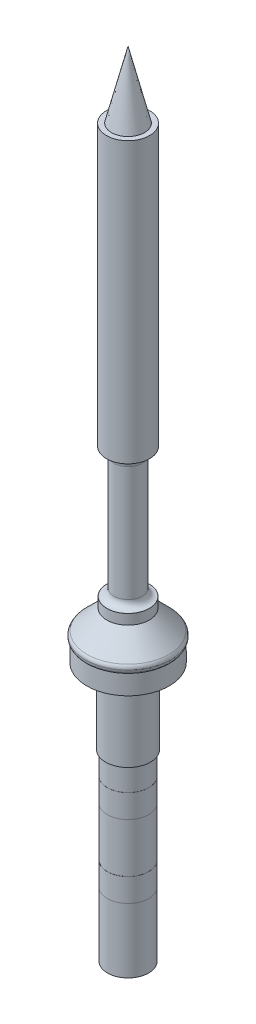
from build123d import *

# Parameters (mm, degrees)
SKETCH1_R            = 2.875
BOSS_EXTRUDE1_DEPTH  = 9.7
SKETCH2_R            = 5.3
BOSS_EXTRUDE2_DEPTH  = 2.5
SKETCH3_R            = 5.475
BOSS_EXTRUDE3_DEPTH  = 0.8
SKETCH4_R            = 5.475
BOSS_EXTRUDE4_DEPTH  = 2.75
BOSS_EXTRUDE4_TAPER  = 45
SKETCH5_R            = 2.725
BOSS_EXTRUDE5_DEPTH  = 1.3
SKETCH6_R            = 1.805
BOSS_EXTRUDE6_DEPTH  = 16.7
SKETCH7_R            = 2.775
BOSS_EXTRUDE7_DEPTH  = 36
SKETCH9_R            = 2.65
BOSS_EXTRUDE9_DEPTH  = 23.6
SKETCH10_R           = 2.66
SKETCH10_R_2         = 2.65
BOSS_EXTRUDE10_DEPTH = 3
SKETCH12_R           = 2.66
SKETCH12_R_2         = 2.65
BOSS_EXTRUDE11_DEPTH = 3
FILLET1_R            = 0.7
FILLET2_R            = 0.9
FILLET3_R            = 1
FILLET4_R            = 0.3


with BuildPart() as part:
    # Sketch1 → Boss-Extrude1 (new body)
    with BuildSketch(Plane(origin=(0, 0, 0), x_dir=(1, 0, 0), z_dir=(0, 1, 0))):
        with Locations(Location((0, 0, 0), (0, 0, 270))):
            Circle(SKETCH1_R)
    extrude(amount=BOSS_EXTRUDE1_DEPTH)

    # Sketch2 → Boss-Extrude2 (add)
    with BuildSketch(Plane(origin=(0, 9.7, 0), x_dir=(1, 0, 0), z_dir=(0, 1, 0))):
        with Locations(Location((0, 0, 0), (0, 0, 270))):
            Circle(SKETCH2_R)
    extrude(amount=BOSS_EXTRUDE2_DEPTH)

    # Sketch3 → Boss-Extrude3 (add)
    with BuildSketch(Plane(origin=(0, 12.2, 0), x_dir=(1, 0, 0), z_dir=(0, 1, 0))):
        with Locations(Location((0, 0, 0), (0, 0, 270))):
            Circle(SKETCH3_R)
    extrude(amount=BOSS_EXTRUDE3_DEPTH)

    # Sketch4 → Boss-Extrude4 (add)
    with BuildSketch(Plane(origin=(0, 13, 0), x_dir=(1, 0, 0), z_dir=(0, 1, 0))):
        with Locations(Location((0, 0, 0), (0, 0, 270))):
            Circle(SKETCH4_R)
    extrude(amount=BOSS_EXTRUDE4_DEPTH, taper=BOSS_EXTRUDE4_TAPER)

    # Sketch5 → Boss-Extrude5 (add)
    with BuildSketch(Plane(origin=(0, 15.75, 0), x_dir=(1, 0, 0), z_dir=(0, 1, 0))):
        with Locations(Location((0, 0, 0), (0, 0, 270))):
            Circle(SKETCH5_R)
    extrude(amount=BOSS_EXTRUDE5_DEPTH)

    # Sketch6 → Boss-Extrude6 (add)
    with BuildSketch(Plane(origin=(0, 17.05, 0), x_dir=(1, 0, 0), z_dir=(0, 1, 0))):
        with Locations(Location((0, 0, 0), (0, 0, 270))):
            Circle(SKETCH6_R)
    extrude(amount=BOSS_EXTRUDE6_DEPTH)

    # Sketch7 → Boss-Extrude7 (add)
    with BuildSketch(Plane(origin=(0, 33.75, 0), x_dir=(1, 0, 0), z_dir=(0, 1, 0))):
        with Locations(Location((0, 0, 0), (0, 0, 270))):
            Circle(SKETCH7_R)
    extrude(amount=BOSS_EXTRUDE7_DEPTH)

    # Boss-Extrude8 cone 1 section (through the dimple's axis) → Boss-Extrude8 (revolve)
    with BuildSketch(Plane(origin=(0, 69.75, 0), x_dir=(0, 0, -1), z_dir=(1, 0, 0))):
        Polygon((0, 0), (2.125, 0), (0, 8.586726604), align=None)
    revolve(axis=Axis((0, 69.75, 0), (0, 1, 0)))

    # Fillet1
    # the kernel refuses this fillet: 0.7 mm, written as the material it takes off along each edge
    with BuildSketch(Plane(origin=(0, 12.2, 0), x_dir=(0, 0, 1), z_dir=(-1, 0, 0))) as fillet1_piece_1:
        with BuildLine():
            CenterArc((4.775, 0.463006479), FILLET1_R, 318.590377891, 41.409622109)
            Line((5.3, 0), (5.3105, -0.00926013))
            ThreePointArc((5.3105, -0.00926013), (5.3875, -0.014), (5.475, -0.014))
            Line((5.475, -0.014), (5.489, 0))
            Line((5.489, 0), (5.489, 0.463006479))
            Line((5.489, 0.463006479), (5.475, 0.463006479))
        make_face()
    revolve(axis=Axis((0, 12.2, 0), (0, 1, 0)), mode=Mode.SUBTRACT)
    with BuildSketch(Plane(origin=(0, 13, 0), x_dir=(0, 0, 1), z_dir=(-1, 0, 0))) as fillet1_piece_2:
        with BuildLine():
            CenterArc((5.475 - FILLET1_R, -FILLET1_R * 0.414213562373), FILLET1_R, 0, 45)
            Line((5.475, -FILLET1_R * 0.414213562373), (5.475 + FILLET1_R * 0.02, -FILLET1_R * 0.414213562373))
            Line((5.475 + FILLET1_R * 0.02, -FILLET1_R * 0.414213562373), (5.475 + FILLET1_R * 0.02, FILLET1_R * 0.00828427124746))
            Line((5.475 + FILLET1_R * 0.02, FILLET1_R * 0.00828427124746), (5.475 - FILLET1_R * 0.27875108319, FILLET1_R * 0.307035354437))
            Line((5.475 - FILLET1_R * 0.27875108319, FILLET1_R * 0.307035354437), (5.475 - FILLET1_R * 0.292893218813, FILLET1_R * 0.292893218813))
        make_face()
    revolve(axis=Axis((0, 13, 0), (0, 1, 0)), mode=Mode.SUBTRACT)

    # Fillet2
    fillet2_edges = [part.edges().sort_by_distance(p)[0] for p in [
        (0, 17.05, -1.805),
    ]]
    fillet(fillet2_edges, radius=FILLET2_R)

    # Fillet3
    # the kernel refuses this fillet: 1 mm, written as the material it adds along each edge
    with BuildSketch(Plane(origin=(0, 33.75, 0), x_dir=(0, 0, 1), z_dir=(-1, 0, 0))) as fillet3_piece_1_section:
        with BuildLine():
            CenterArc((1.805 + FILLET3_R, -FILLET3_R), FILLET3_R, 90, 90)
            Line((1.805 + FILLET3_R, 0), (1.805, 0))
            Line((1.805, 0), (1.805, -FILLET3_R))
        make_face()
    fillet3_piece_1 = revolve(axis=Axis((0, 33.75, 0), (0, 1, 0)), mode=Mode.PRIVATE)
    fillet3_piece_1 = fillet3_piece_1 & Plane(origin=(0, 33.456728923, 0), x_dir=(0, 0, 1), z_dir=(0, -1, 0)) * Cylinder(2.775, 12, mode=Mode.PRIVATE)
    add(fillet3_piece_1)

    # Fillet4
    fillet4_edges = [part.edges().sort_by_distance(p)[0] for p in [
        (0, 9.7, -2.875),
    ]]
    fillet(fillet4_edges, radius=FILLET4_R)


with BuildPart() as body_2:
    # Sketch9 → Boss-Extrude9 (new body)
    with BuildSketch(Plane.XZ):
        with Locations(Location((0, 0, 0), (0, 0, 270))):
            Circle(SKETCH9_R)
    extrude(amount=BOSS_EXTRUDE9_DEPTH)


with BuildPart() as body_3:
    # Sketch10 → Boss-Extrude10 (new body)
    with BuildSketch(Plane(origin=(0, -2.95, 0), x_dir=(-1, 0, 0), z_dir=(0, -1, 0))):
        with Locations(Location((0, 0, 0), (0, 0, 90))):
            Circle(SKETCH10_R)
        with Locations(Location((0, 0, 0), (0, 0, 90))):
            Circle(SKETCH10_R_2, mode=Mode.SUBTRACT)
    extrude(amount=BOSS_EXTRUDE10_DEPTH)


with BuildPart() as body_4:
    # Sketch12 → Boss-Extrude11 (new body)
    with BuildSketch(Plane(origin=(0, -12.3, 0), x_dir=(-1, 0, 0), z_dir=(0, -1, 0))):
        with Locations(Location((0, 0, 0), (0, 0, 90))):
            Circle(SKETCH12_R)
        with Locations(Location((0, 0, 0), (0, 0, 90))):
            Circle(SKETCH12_R_2, mode=Mode.SUBTRACT)
    extrude(amount=BOSS_EXTRUDE11_DEPTH)


solid = Compound([part.part, body_2.part, body_3.part, body_4.part])
